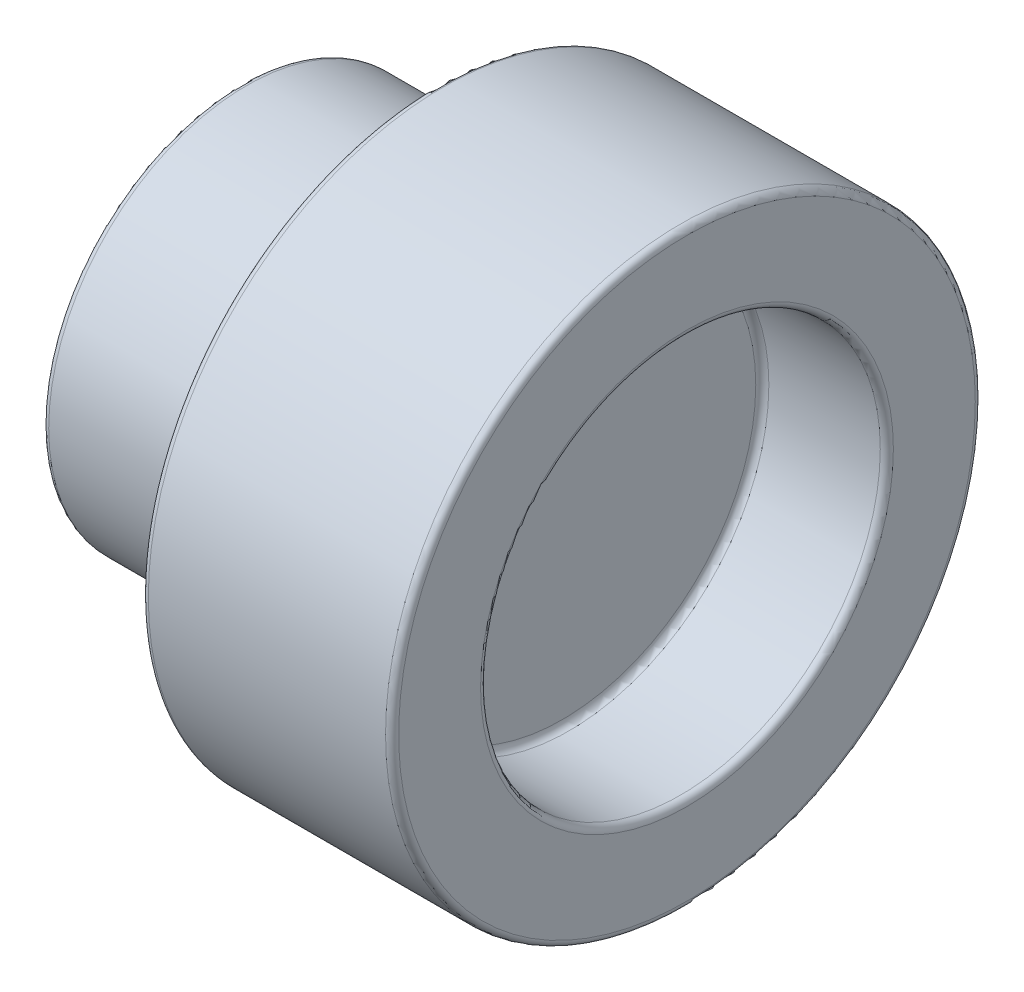
from build123d import *

# Parameters (mm, degrees)
SKETCH_1_R           = 4.5
SKETCH_1_R_2         = 3.05
EXTRUDE_1_DEPTH      = 3.82
EXTRUDE_2_DEPTH      = 3
EXTRUDE_2_DEPTH_BACK = 1.92
SKETCH_2_R           = 3.05
SKETCH_3_R           = 3.05
SKETCH_3_R_2         = 3.02
CUT_EXTRUDE_1_DEPTH  = 3
FILLET_1_R           = 0.1
FILLET_2_R           = 0.1
FILLET_3_R           = 0.1
FILLET_4_R           = 0.1


with BuildPart() as part:
    # 草图1 → 凸台-拉伸1 (new body)
    with BuildSketch(Plane(origin=(0, 0, 0), x_dir=(0, 0, -1), z_dir=(1, 0, 0))):
        with Locations(Location((0, 0, 0), (0, 0, 180))):
            Circle(SKETCH_1_R)
        with Locations(Location((0, 0, 0), (0, 0, 180))):
            Circle(SKETCH_1_R_2, mode=Mode.SUBTRACT)
    extrude(amount=EXTRUDE_1_DEPTH)

    # 圆角1
    fillet_1_edges = [part.edges().sort_by_distance(p)[0] for p in [
        (0, 0, -4.5),
        (3.82, 0, -4.5),
        (3.82, 0, -3.05),
    ]]
    fillet(fillet_1_edges, radius=FILLET_1_R)


with BuildPart() as body_2:
    # 草图2 → 凸台-拉伸2 (new, two sides: drawn at the far end of the back side and taken through both)
    with BuildSketch(Plane.ZY.offset(-EXTRUDE_2_DEPTH_BACK)):
        Circle(SKETCH_2_R)
    extrude(amount=EXTRUDE_2_DEPTH + EXTRUDE_2_DEPTH_BACK)

    # 草图3 → 切除-拉伸1 (cut)
    with BuildSketch(Plane.ZY.offset(3)):
        with Locations(Location((0, 0, 0), (0, 0, 180))):
            Circle(SKETCH_3_R)
        Circle(SKETCH_3_R_2, mode=Mode.SUBTRACT)
    extrude(amount=-CUT_EXTRUDE_1_DEPTH, mode=Mode.SUBTRACT)

    # 圆角2
    fillet_2_edges = [body_2.edges().sort_by_distance(p)[0] for p in [
        (-3, 0, -3.02),
    ]]
    fillet(fillet_2_edges, radius=FILLET_2_R)

    # 圆角3
    # the kernel refuses this fillet: 0.1 mm, written as the material it adds along each edge
    with BuildSketch(Plane(origin=(0, 0, 0), x_dir=(0, 0, 1), z_dir=(0, -1, 0))) as fillet_3_piece_1:
        with BuildLine():
            CenterArc((3.12, 0.071414284), FILLET_3_R, 180, 45.572995999)
            Line((3.05, 0), (3.0486, -0.001428286))
            ThreePointArc((3.0486, -0.001428286), (3.035, -0.002), (3.02, -0.002))
            Line((3.02, -0.002), (3.018, 0))
            Line((3.018, 0), (3.018, 0.071414284))
            Line((3.018, 0.071414284), (3.02, 0.071414284))
        make_face()
    revolve(axis=Axis((0, 0, 0), (-1, 0, 0)))


with BuildPart() as part_1:
    add(part.part)

    # Combine 1: union body 2
    add(body_2.part)

    # 圆角4
    fillet_4_edges = [part_1.edges().sort_by_distance(p)[0] for p in [
        (1.92, 0, -3.05),
    ]]
    fillet(fillet_4_edges, radius=FILLET_4_R)


solid = part_1.part
